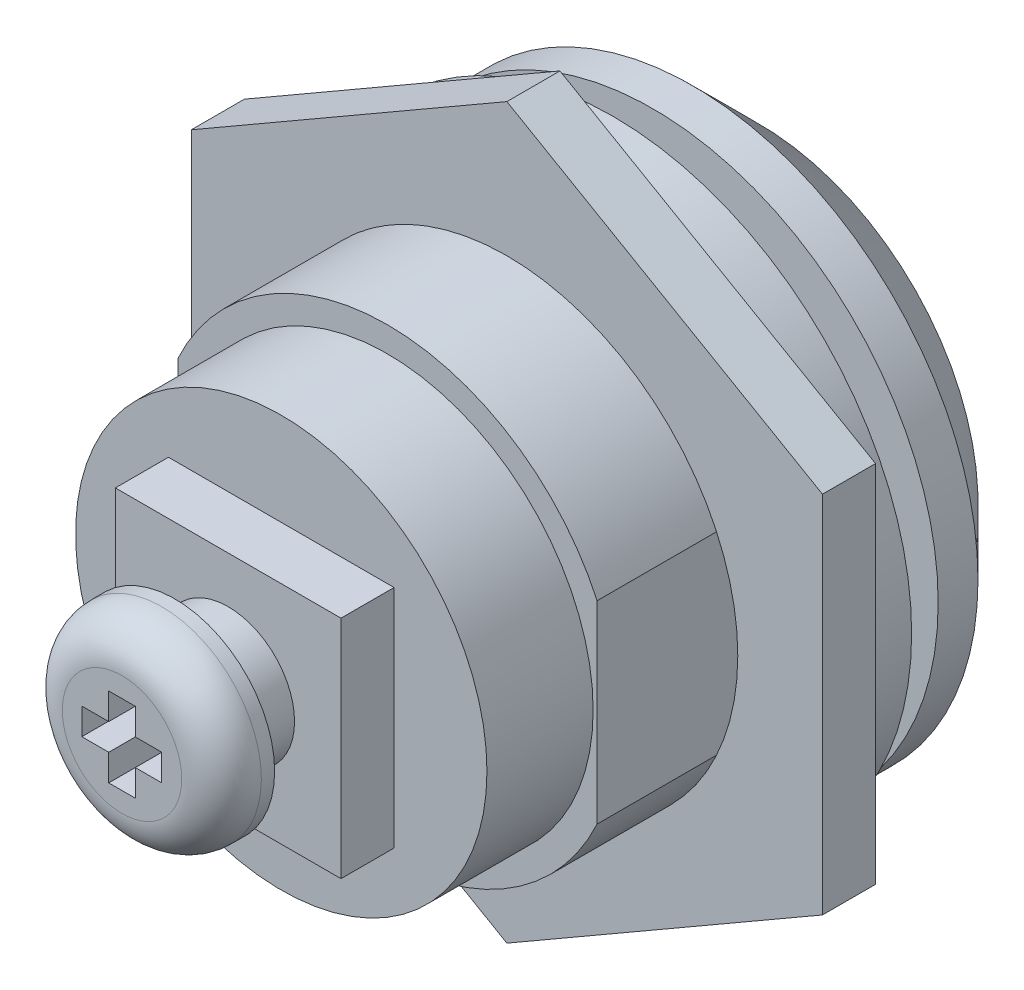
from build123d import *

# Parameters (mm, degrees)
EXTRUDE_1_DEPTH     = 14
SKETCH_3_R          = 10.75
EXTRUDE_2_DEPTH     = 4
CHAMFER_1_SIZE      = 2.5
SKETCH_4_R          = 11.25
EXTRUDE_3_DEPTH     = 2
SKETCH_5_W          = 8.5
SKETCH_5_H          = 8.5
EXTRUDE_4_DEPTH     = 2
SKETCH_6_R          = 2.5
EXTRUDE_5_DEPTH     = 2
SKETCH_7_R          = 3.75
EXTRUDE_6_DEPTH     = 2
FILLET_1_R          = 1.5
CUT_EXTRUDE_1_DEPTH = 2
SKETCH_9_R          = 8.7
EXTRUDE_7_DEPTH     = 2
SKETCH_12_R         = 7.25
EXTRUDE_8_DEPTH     = 0.2
FILLET_2_R          = 0.2
CUT_EXTRUDE_2_DEPTH = 18.2
CUT_EXTRUDE_START   = -4
SKETCH_13_R         = 7.75
CUT_EXTRUDE_3_DEPTH = 4


with BuildPart() as part:
    # 草图1 → 拉伸1 (new body)
    with BuildSketch(Plane.XY):
        with BuildLine():
            Line((7.9, 3.644173432), (7.9, -3.644173432))
            ThreePointArc((7.9, -3.644173432), (0, -8.7), (-7.9, -3.644173432))
            Line((-7.9, -3.644173432), (-7.9, 3.644173432))
            ThreePointArc((-7.9, 3.644173432), (0, 8.7), (7.9, 3.644173432))
        make_face()
    extrude(amount=EXTRUDE_1_DEPTH)

    # 草图3 → 拉伸2 (add)
    with BuildSketch(Plane(origin=(0, 0, 0), x_dir=(-1, 0, 0), z_dir=(0, 0, -1))):
        Circle(SKETCH_3_R)
    extrude(amount=EXTRUDE_2_DEPTH)

    # 倒角1
    chamfer_1_edges = [part.edges().sort_by_distance(p)[0] for p in [
        (10.75, 0, -4),
    ]]
    chamfer(chamfer_1_edges, length=CHAMFER_1_SIZE)

    # 草图4 → 拉伸3 (add)
    with BuildSketch(Plane.XY.offset(1.5)):
        Circle(SKETCH_4_R)
        with BuildLine():
            Line((-7.11658576, 3.762539983), (-7.11658576, -3.762539983))
            ThreePointArc((-7.11658576, -3.762539983), (0, -8.05), (7.11658576, -3.762539983))
            Line((7.11658576, -3.762539983), (7.11658576, 3.762539983))
            ThreePointArc((7.11658576, 3.762539983), (0, 8.05), (-7.11658576, 3.762539983))
        make_face(mode=Mode.SUBTRACT)
    extrude(amount=EXTRUDE_3_DEPTH)

    # 草图5 → 拉伸4 (add)
    with BuildSketch(Plane.XY.offset(14)):
        Rectangle(SKETCH_5_W, SKETCH_5_H)
    extrude(amount=EXTRUDE_4_DEPTH)

    # 草图6 → 拉伸5 (add)
    with BuildSketch(Plane.XY.offset(16)):
        Circle(SKETCH_6_R)
    extrude(amount=EXTRUDE_5_DEPTH)

    # 草图7 → 拉伸6 (add)
    with BuildSketch(Plane.XY.offset(18)):
        Circle(SKETCH_7_R)
    extrude(amount=EXTRUDE_6_DEPTH)

    # 圆角1
    fillet_1_edges = [part.edges().sort_by_distance(p)[0] for p in [
        (-3.75, 0, 20),
    ]]
    fillet(fillet_1_edges, radius=FILLET_1_R)

    # 草图8 → 切除-拉伸1 (cut)
    with BuildSketch(Plane.XY.offset(20)):
        Polygon((-1.514696486, 0.5), (-0.5, 0.5), (-0.5, 1.5), (0.5, 1.5), (0.5, 0.5), (1.485303514, 0.5), (1.485303514, -0.5), (0.5, -0.5), (0.5, -1.5), (-0.5, -1.5), (-0.5, -0.5), (-1.514696486, -0.5), align=None)
    extrude(amount=-CUT_EXTRUDE_1_DEPTH, mode=Mode.SUBTRACT)

    # 草图12 → 拉伸8 (add)
    with BuildSketch(Plane(origin=(0, 0, -4), x_dir=(-1, 0, 0), z_dir=(0, 0, -1))):
        Circle(SKETCH_12_R)
    extrude(amount=EXTRUDE_8_DEPTH)

    # 圆角2
    fillet_2_edges = [part.edges().sort_by_distance(p)[0] for p in [
        (7.25, 0, -4.2),
    ]]
    fillet(fillet_2_edges, radius=FILLET_2_R - 0.0001)  # a hair under: the kernel refuses the full size

    # 草图10 → 切除-拉伸2 (cut)
    with BuildSketch(Plane(origin=(0, 0, -4.2), x_dir=(-1, 0, 0), z_dir=(0, 0, -1))):
        Polygon((-0.9, 3.5), (-0.9, -3.5), (0, -3.5), (0, -0.7), (0.9, -0.7), (0.9, 3.5), align=None)
    extrude(amount=-CUT_EXTRUDE_2_DEPTH, mode=Mode.SUBTRACT)

    # 草图13 → 切除-拉伸3 (cut)
    with BuildSketch(Plane.XY.offset(14).offset(CUT_EXTRUDE_START)):
        with BuildLine():
            Line((7.9, -3.644173432), (7.9, 3.644173432))
            ThreePointArc((7.9, 3.644173432), (0, 8.7), (-7.9, 3.644173432))
            Line((-7.9, 3.644173432), (-7.9, -3.644173432))
            ThreePointArc((-7.9, -3.644173432), (0, -8.7), (7.9, -3.644173432))
        make_face()
        Circle(SKETCH_13_R, mode=Mode.SUBTRACT)
    extrude(amount=CUT_EXTRUDE_3_DEPTH, mode=Mode.SUBTRACT)


with BuildPart() as body_2:
    # 草图9 → 拉伸7 (new body)
    with BuildSketch(Plane.XY.offset(3.5)):
        Polygon((11.890098709, -6.86475169), (0, -13.72950338), (-11.890098709, -6.86475169), (-11.890098709, 6.86475169), (0, 13.72950338), (11.890098709, 6.86475169), align=None)
        Circle(SKETCH_9_R, mode=Mode.SUBTRACT)
    extrude(amount=EXTRUDE_7_DEPTH)


solid = Compound([part.part, body_2.part])
